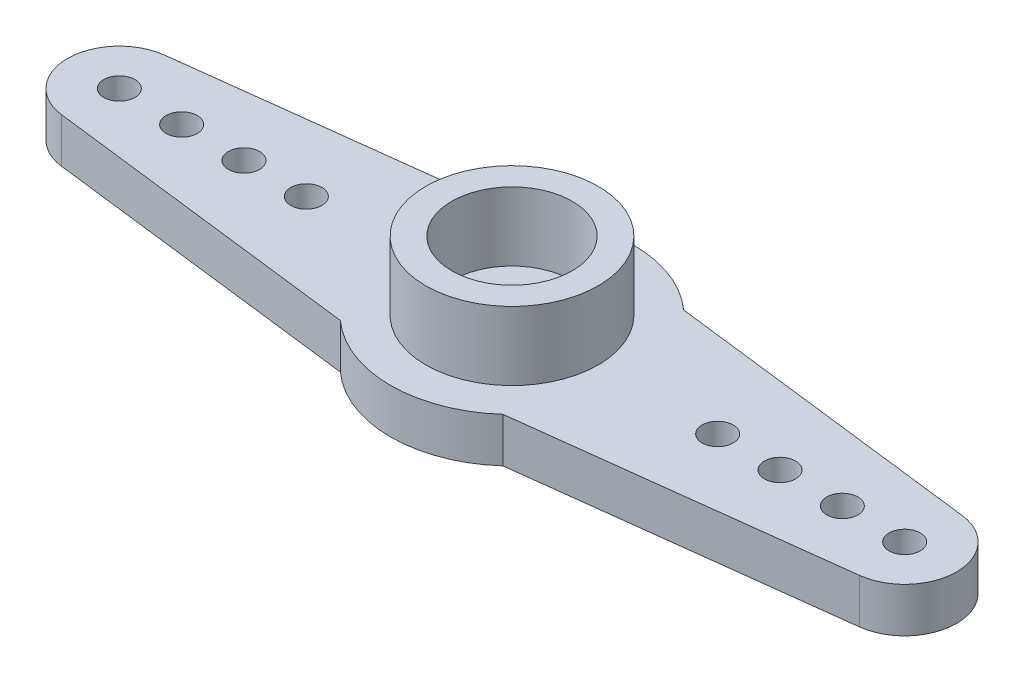
from build123d import *

# Parameters (mm, degrees)
SKETCH1_R           = 0.75
SKETCH1_R_2         = 1.25
BOSS_EXTRUDE1_DEPTH = 2.15
SKETCH2_R           = 4.15
SKETCH2_R_2         = 2.9
BOSS_EXTRUDE2_DEPTH = 3.3


with BuildPart() as part:
    # Sketch1 → Boss-Extrude1 (new body)
    with BuildSketch(Plane(origin=(0, 0, 0), x_dir=(1, 0, 0), z_dir=(0, 1, 0))):
        with BuildLine():
            Line((-3.911521443, 4.35), (-19.203214028, 2.481544127))
            ThreePointArc((-19.203214028, 2.481544127), (-21.4, 0), (-19.203214028, -2.481544127))
            Line((-19.203214028, -2.481544127), (-3.911521443, -4.35))
            ThreePointArc((-3.911521443, -4.35), (0, -5.85), (3.911521443, -4.35))
            Line((3.911521443, -4.35), (19.203214028, -2.481544127))
            ThreePointArc((19.203214028, -2.481544127), (21.4, 0), (19.203214028, 2.481544127))
            Line((19.203214028, 2.481544127), (3.911521443, 4.35))
            ThreePointArc((3.911521443, 4.35), (0, 5.85), (-3.911521443, 4.35))
        make_face()
        with Locations((-18.9, 0)):
            Circle(SKETCH1_R, mode=Mode.SUBTRACT)
        with Locations((-15.9, 0)):
            Circle(SKETCH1_R, mode=Mode.SUBTRACT)
        with Locations((-12.9, 0)):
            Circle(SKETCH1_R, mode=Mode.SUBTRACT)
        with Locations((-9.9, 0)):
            Circle(SKETCH1_R, mode=Mode.SUBTRACT)
        Circle(SKETCH1_R_2, mode=Mode.SUBTRACT)
        with Locations((15.9, 0)):
            Circle(SKETCH1_R, mode=Mode.SUBTRACT)
        with Locations((18.9, 0)):
            Circle(SKETCH1_R, mode=Mode.SUBTRACT)
        with Locations((9.9, 0)):
            Circle(SKETCH1_R, mode=Mode.SUBTRACT)
        with Locations((12.9, 0)):
            Circle(SKETCH1_R, mode=Mode.SUBTRACT)
    extrude(amount=BOSS_EXTRUDE1_DEPTH)

    # Sketch2 → Boss-Extrude2 (add)
    with BuildSketch(Plane(origin=(0, 2.15, 0), x_dir=(1, 0, 0), z_dir=(0, 1, 0))):
        Circle(SKETCH2_R)
        Circle(SKETCH2_R_2, mode=Mode.SUBTRACT)
    extrude(amount=BOSS_EXTRUDE2_DEPTH)


solid = part.part
